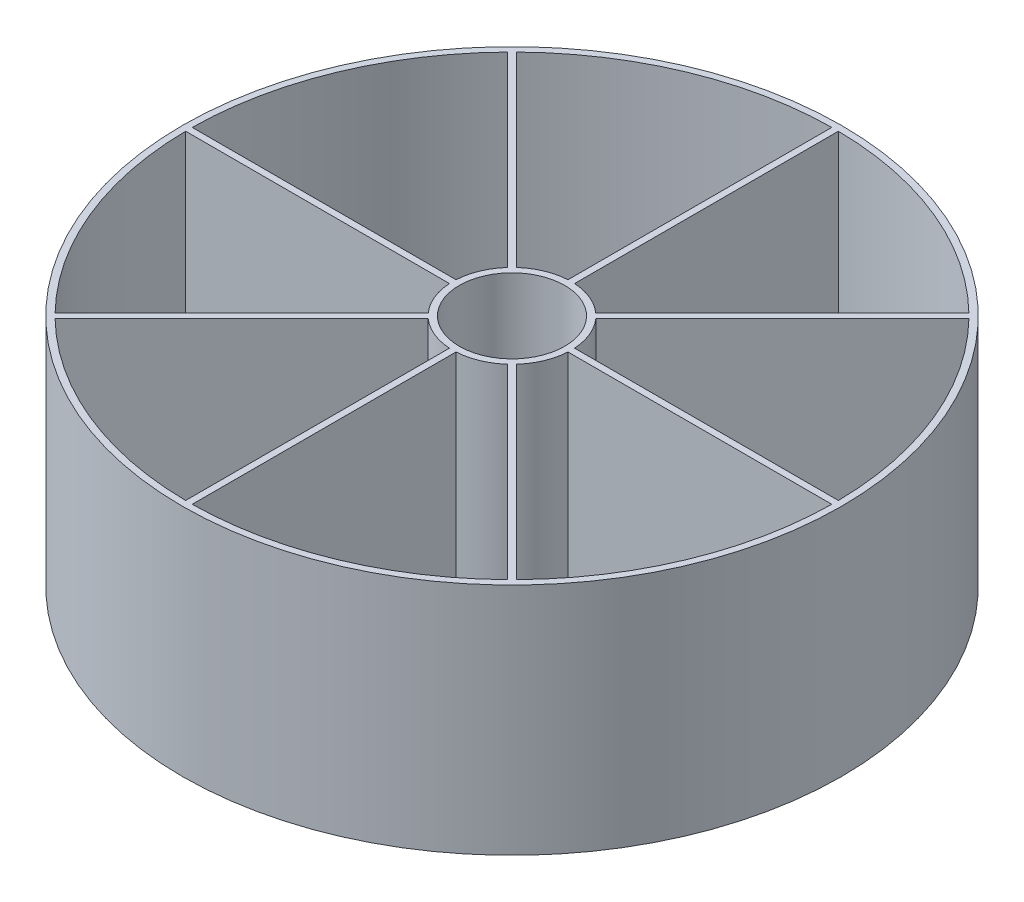
from build123d import *
from build123d.topology import SkipClean

# Parameters (mm, degrees)
SKETCH2_R           = 100
SKETCH2_R_2         = 98
BOSS_EXTRUDE2_DEPTH = 70
SKETCH3_R           = 18
SKETCH3_R_2         = 16
BOSS_EXTRUDE3_DEPTH = 70
BOSS_EXTRUDE4_DEPTH = 70
CIRPATTERN1_COUNT   = 8
BOSS_EXTRUDE5_START = 1
SKETCH5_R           = 100
BOSS_EXTRUDE5_DEPTH = 1
CUT_EXTRUDE1_START  = -2
CUT_EXTRUDE1_DEPTH  = 2
CIRPATTERN2_COUNT   = 8
SKETCH9_R           = 16
BOSS_EXTRUDE6_DEPTH = 10
CUT_EXTRUDE2_DEPTH  = 154.622914957


with BuildPart() as part:
    # Sketch2 → Boss-Extrude2 (new body)
    with BuildSketch(Plane(origin=(0, 0, 0), x_dir=(1, 0, 0), z_dir=(0, 1, 0))):
        Circle(SKETCH2_R)
        Circle(SKETCH2_R_2, mode=Mode.SUBTRACT)
    extrude(amount=BOSS_EXTRUDE2_DEPTH)



with BuildPart() as body_2:
    # Sketch3 → Boss-Extrude3 (new body)
    with BuildSketch(Plane(origin=(0, 0, 0), x_dir=(1, 0, 0), z_dir=(0, 1, 0))):
        Circle(SKETCH3_R)
        Circle(SKETCH3_R_2, mode=Mode.SUBTRACT)
    extrude(amount=BOSS_EXTRUDE3_DEPTH)

    # Sketch4 → Boss-Extrude4 (add)
    with BuildSketch(Plane(origin=(0, 0, 0), x_dir=(1, 0, 0), z_dir=(0, 1, 0))):
        with BuildLine():
            ThreePointArc((1, -17.972200756), (0, -18), (-1, -17.972200756))
            Line((-1, -17.972200756), (-1, -97.994897826))
            ThreePointArc((-1, -97.994897826), (0, -98), (1, -97.994897826))
            Line((1, -97.994897826), (1, -17.972200756))
        make_face()
    boss_extrude4 = extrude(amount=BOSS_EXTRUDE4_DEPTH)

    # CirPattern1: Boss-Extrude4 ×8 about axis
    cirpattern1_axis = Axis((0, 70, 0), (0, -1, 0))
    for i in range(1, CIRPATTERN1_COUNT):
        add(boss_extrude4.rotate(cirpattern1_axis, i * 360 / CIRPATTERN1_COUNT))


with BuildPart() as part_1:
    add(part.part)

    add(body_2.part)  # Boss-Extrude5 merges body 2
    # Sketch5 → Boss-Extrude5 (add)
    with BuildSketch(Plane.XZ.offset(BOSS_EXTRUDE5_START)):
        Circle(SKETCH5_R)
    extrude(amount=-BOSS_EXTRUDE5_DEPTH)

    # Sketch6 → Cut-Extrude1 (cut)
    with SkipClean():  # the faces are left unmerged after this step: merging them gives an invalid solid
        with BuildSketch(Plane(origin=(0, 0, 0), x_dir=(1, 0, 0), z_dir=(0, 1, 0)).offset(CUT_EXTRUDE1_START)):
            with BuildLine():
                Line((-97.994897826, -1), (-57.994897826, -1))
                ThreePointArc((-57.994897826, -1), (-53.588263679, -22.1969856), (-41.715692308, -40.301478746))
                Line((-41.715692308, -40.301478746), (-69.999963556, -68.585749994))
                ThreePointArc((-69.999963556, -68.585749994), (-90.540194186, -37.502976372), (-97.994897826, -1))
            make_face()
        cut_extrude1 = extrude(amount=CUT_EXTRUDE1_DEPTH, mode=Mode.SUBTRACT)

    # CirPattern2: Cut-Extrude1 ×8 about axis
    with SkipClean():  # the faces are left unmerged after this step: merging them gives an invalid solid
        cirpattern2_axis = Axis((0, 70, 0), (0, -1, 0))
        for i in range(1, CIRPATTERN2_COUNT):
            add(cut_extrude1.rotate(cirpattern2_axis, i * 360 / CIRPATTERN2_COUNT), mode=Mode.SUBTRACT)

    # Sketch9 → Boss-Extrude6 (add)
    with BuildSketch(Plane(origin=(0, 0, 0), x_dir=(1, 0, 0), z_dir=(0, 1, 0))):
        Circle(SKETCH9_R)
    extrude(amount=BOSS_EXTRUDE6_DEPTH)

    # Sketch10 → Cut-Extrude2 (cut, through all)
    with BuildSketch(Plane(origin=(0, 10, 0), x_dir=(1, 0, 0), z_dir=(0, 1, 0))):
        Polygon((0, 16), (-13.856406461, 8), (-13.856406461, -8), (0, -16), (13.856406461, -8), (13.856406461, 8), align=None)
    extrude(amount=-CUT_EXTRUDE2_DEPTH, mode=Mode.SUBTRACT)


solid = part_1.part
